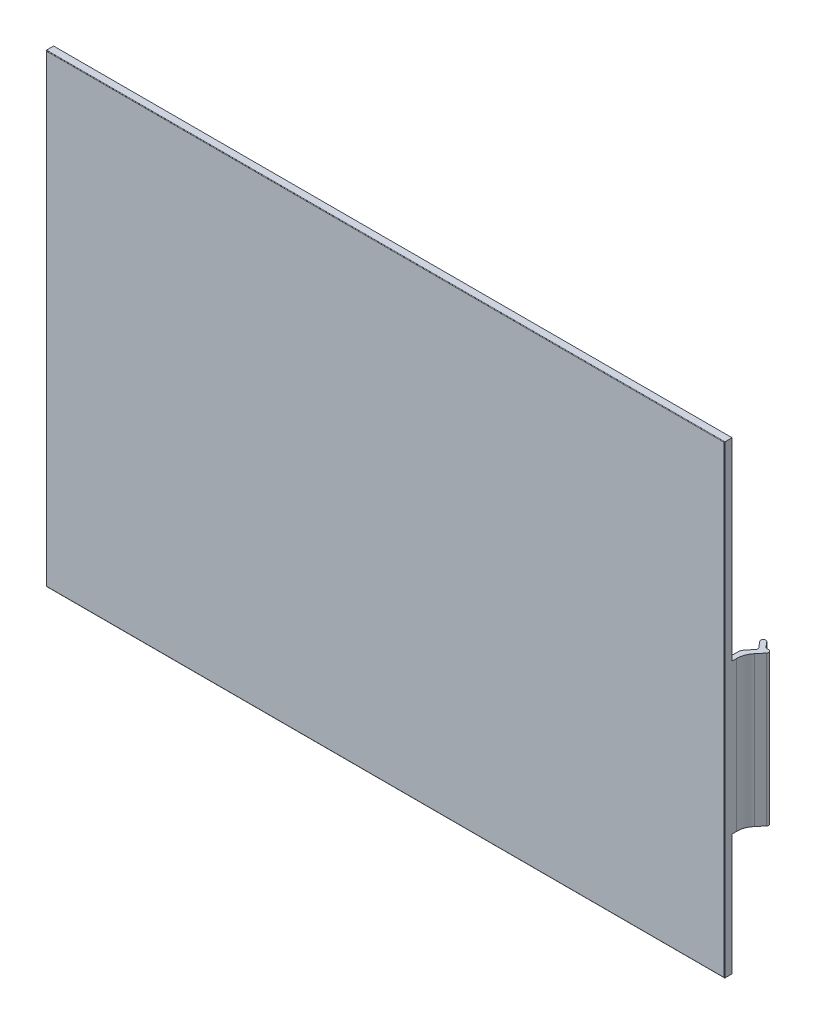
from build123d import *

# Parameters (mm, degrees)
STOCK_OUTTER_CASE_1_START     = -135
STOCK_OUTTER_CASE_1_OUTLINE_W = 184.8
STOCK_OUTTER_CASE_1_OUTLINE_H = 3
STOCK_OUTTER_CASE_1_DEPTH     = 270
FILLET1_R                     = 0.2
BOSS_EXTRUDE1_DEPTH           = 29.8
FILLET2_R                     = 3
FILLET2_OF_MIRROR1_R          = 3
BOSS_EXTRUDE2_DEPTH           = 59.6
FILLET3_R                     = 0.5


# Read off the part's stored shape, not the designer's step: Stock-outter_case-1
with BuildPart() as part:
    # Stock-outter_case-1 outline → Stock-outter_case-1 (new body)
    with BuildSketch(Plane.YZ.offset(STOCK_OUTTER_CASE_1_START)):
        with Locations((88.4, 94.5)):
            Rectangle(STOCK_OUTTER_CASE_1_OUTLINE_W, STOCK_OUTTER_CASE_1_OUTLINE_H)
    extrude(amount=STOCK_OUTTER_CASE_1_DEPTH)

    # Fillet1
    fillet1_edges = [part.edges().sort_by_distance(p)[0] for p in [
        (0, 180.8, 96),
        (0, -4, 96),
        (135, 88.4, 96),
        (-135, 88.4, 96),
    ]]
    fillet(fillet1_edges, radius=FILLET1_R)

    # Sketch2 → Boss-Extrude1 (add, symmetric)
    with BuildSketch(Plane(origin=(0, 74, 0), x_dir=(1, 0, 0), z_dir=(0, 1, 0))):
        with BuildLine():
            Line((133, -93), (135, -93))
            Line((135, -93), (135, -91.139702343))
            ThreePointArc((135, -91.139702343), (135.482459034, -88.403541196), (136.871644455, -85.997401465))
            Line((136.871644455, -85.997401465), (137.206664088, -85.598140613))
            ThreePointArc((137.206664088, -85.598140613), (137.908530759, -83.669777784), (137.206664088, -81.741414955))
            Line((137.206664088, -81.741414955), (135.149743737, -79.290072737))
            ThreePointArc((135.149743737, -79.290072737), (134.606632777, -79.007347067), (134.022678095, -79.191467271))
            Line((134.022678095, -79.191467271), (133.716260318, -79.448582314))
            ThreePointArc((133.716260318, -79.448582314), (133.433534647, -79.991693275), (133.617654851, -80.575647957))
            Line((133.617654851, -80.575647957), (135.674575202, -83.026990175))
            ThreePointArc((135.674575202, -83.026990175), (135.908530759, -83.669777784), (135.674575202, -84.312565394))
            Line((135.674575202, -84.312565394), (133.701866671, -86.663547874))
            ThreePointArc((133.701866671, -86.663547874), (133.180922138, -87.565850273), (133, -88.591910703))
            Line((133, -88.591910703), (133, -93))
        make_face()
    boss_extrude1 = extrude(amount=BOSS_EXTRUDE1_DEPTH, both=True)

    # Fillet2
    fillet2_edges = [part.edges().sort_by_distance(p)[0] for p in [
        (133, 74, 93),
    ]]
    fillet(fillet2_edges, radius=FILLET2_R)

    # Mirror1: Boss-Extrude1 across plane
    add(boss_extrude1.mirror(Plane(origin=(0, 0, 0), x_dir=(0, 0, 1), z_dir=(1, 0, 0))))

    # Fillet2 of Mirror1
    fillet2_of_mirror1_edges = [part.edges().sort_by_distance(p)[0] for p in [
        (-133, 74, 93),
    ]]
    fillet(fillet2_of_mirror1_edges, radius=FILLET2_OF_MIRROR1_R)

    # Sketch3 → Boss-Extrude2 (add)
    with BuildSketch(Plane(origin=(0, 103.8, 0), x_dir=(1, 0, 0), z_dir=(0, 1, 0))):
        with BuildLine():
            Line((137.206664088, -85.598140613), (139.064378688, -83.384202565))
            ThreePointArc((139.064378688, -83.384202565), (139.204642032, -82.318796694), (138.298334245, -81.741414955))
            Line((138.298334245, -81.741414955), (137.206664088, -81.741414955))
            Line((137.206664088, -81.741414955), (137.206664088, -85.598140613))
        make_face()
    boss_extrude2 = extrude(amount=-BOSS_EXTRUDE2_DEPTH)

    # Mirror2: Boss-Extrude2 across plane
    add(boss_extrude2.mirror(Plane(origin=(0, 0, 0), x_dir=(0, 0, 1), z_dir=(1, 0, 0))))

    # Fillet3
    fillet3_edges = [part.edges().sort_by_distance(p)[0] for p in [
        (137.206664088, 74, 81.741414955),
        (-137.206664088, 74, 81.741414955),
    ]]
    fillet(fillet3_edges, radius=FILLET3_R)


solid = part.part
